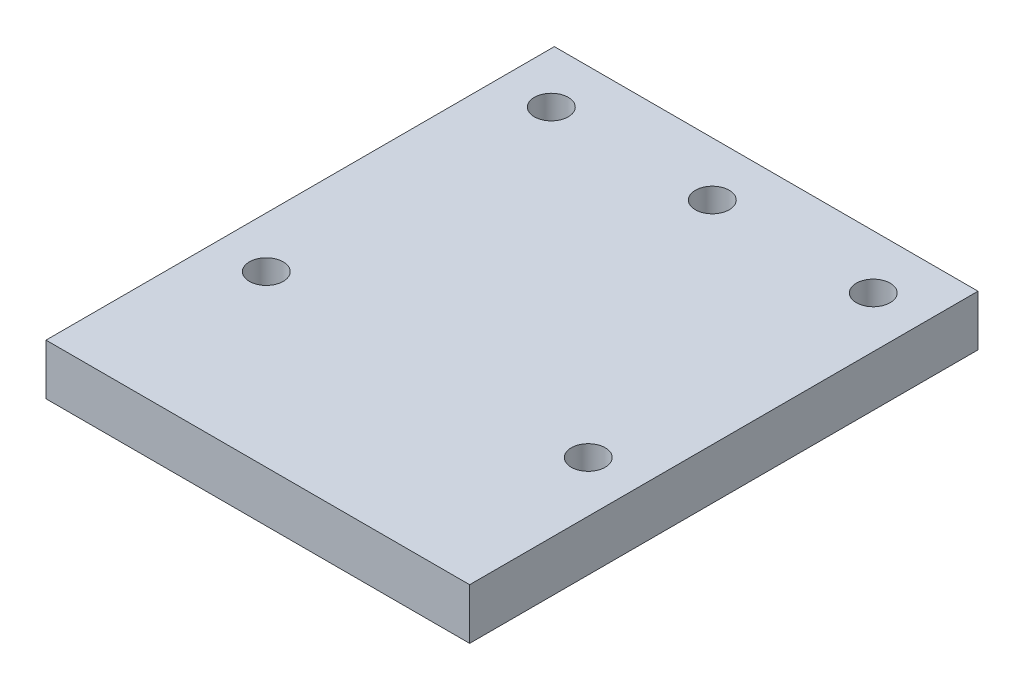
from build123d import *

# Parameters (mm, degrees)
SKETCH1_W           = 25
SKETCH1_H           = 30
SKETCH1_R           = 1
BOSS_EXTRUDE1_DEPTH = 3


with BuildPart() as part:
    # Sketch1 → Boss-Extrude1 (new body)
    with BuildSketch(Plane(origin=(0, 0, 0), x_dir=(1, 0, 0), z_dir=(0, 1, 0))):
        with Locations((12.5, -15)):
            Rectangle(SKETCH1_W, SKETCH1_H)
        with Locations((12.5, -3.18)):
            Circle(SKETCH1_R, mode=Mode.SUBTRACT)
        with Locations((3, -20)):
            Circle(SKETCH1_R, mode=Mode.SUBTRACT)
        with Locations((22, -20)):
            Circle(SKETCH1_R, mode=Mode.SUBTRACT)
        with Locations((22, -3.18)):
            Circle(SKETCH1_R, mode=Mode.SUBTRACT)
        with Locations((3, -3.18)):
            Circle(SKETCH1_R, mode=Mode.SUBTRACT)
    extrude(amount=BOSS_EXTRUDE1_DEPTH)


solid = part.part
